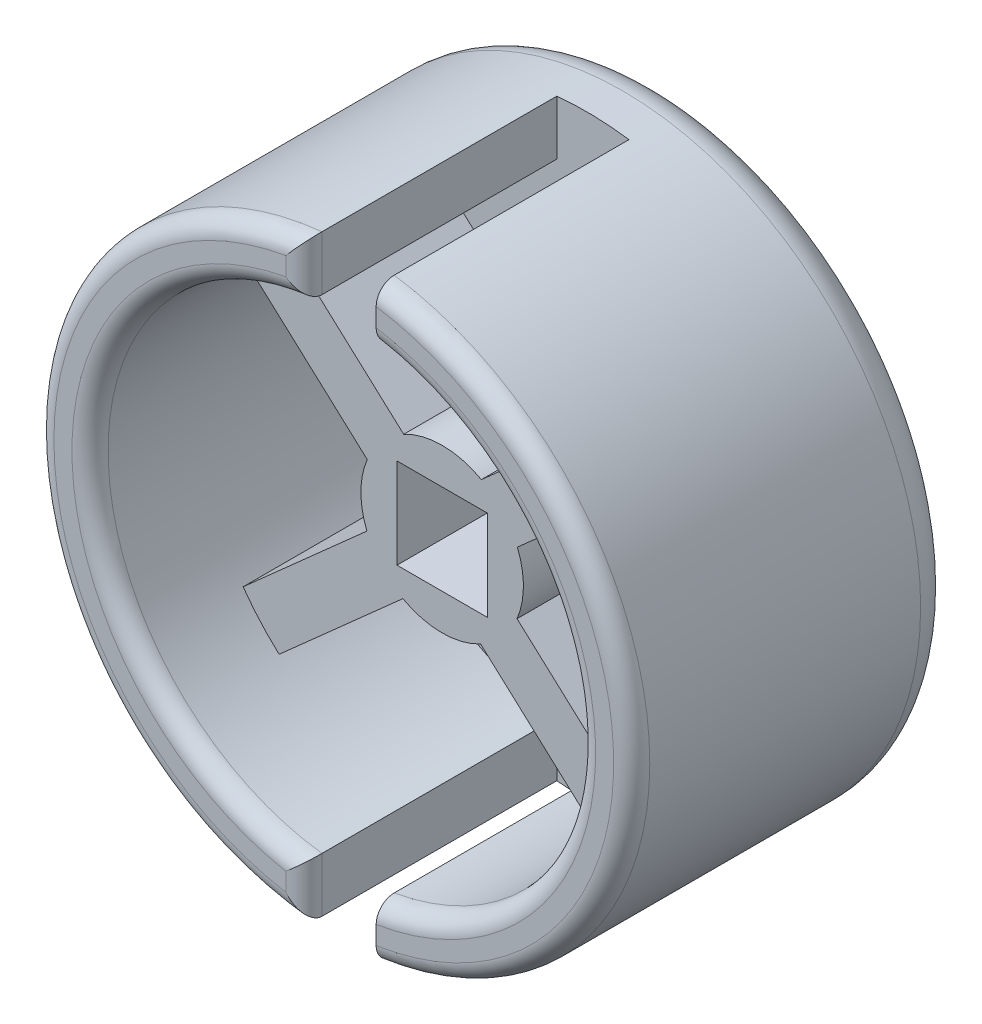
from build123d import *

# Parameters (mm, degrees)
SKETCH_1_R          = 8.25
SKETCH_1_R_2        = 6.75
EXTRUDE_1_DEPTH     = 7
EXTRUDE_START       = 2
SKETCH_2_R          = 8.25
EXTRUDE_1_2_DEPTH   = 2
EXTRUDE_3_DEPTH     = 4
SKETCH_3_W          = 2.5
SKETCH_3_H          = 2.5
CUT_EXTRUDE_1_DEPTH = 15.735162028
SKETCH_6_W          = 2
SKETCH_6_H          = 3.283082556
SKETCH_6_H_2        = 3.547491889
CUT_EXTRUDE_2_DEPTH = 7
FILLET_1_R          = 1
FILLET_2_R          = 0.5


with BuildPart() as part:
    # Эскиз1 → Extrude 1 (new body)
    with BuildSketch(Plane.XY):
        Circle(SKETCH_1_R)
        Circle(SKETCH_1_R_2, mode=Mode.SUBTRACT)
    extrude(amount=EXTRUDE_1_DEPTH)

    # Эскиз2 → Extrude 1 2 (add)
    with BuildSketch(Plane(origin=(0, 0, 0), x_dir=(-1, 0, 0), z_dir=(0, 0, -1)).offset(EXTRUDE_START)):
        Circle(SKETCH_2_R)
    extrude(amount=-EXTRUDE_1_2_DEPTH)

    # Эскиз4 → Бобышка-Вытянуть3 (add)
    with BuildSketch(Plane.XY):
        with BuildLine():
            Line((2.07406055, -0.872222927), (5.968591922, -4.413472559))
            Line((5.968591922, -4.413472559), (4.959463137, -5.523273935))
            Line((4.959463137, -5.523273935), (1.064931765, -1.982024303))
            ThreePointArc((1.064931765, -1.982024303), (-0.012257169, -2.249966613), (-1.08646291, -1.970304125))
            Line((-1.08646291, -1.970304125), (-4.961140395, -5.41713434))
            Line((-4.961140395, -5.41713434), (-5.958117889, -4.296404276))
            Line((-5.958117889, -4.296404276), (-2.083440404, -0.849574061))
            ThreePointArc((-2.083440404, -0.849574061), (-2.249966613, 0.012257169), (-2.07406055, 0.872222927))
            Line((-2.07406055, 0.872222927), (-5.968591922, 4.413472559))
            Line((-5.968591922, 4.413472559), (-4.959463137, 5.523273935))
            Line((-4.959463137, 5.523273935), (-1.064931765, 1.982024303))
            ThreePointArc((-1.064931765, 1.982024303), (0.012257169, 2.249966613), (1.08646291, 1.970304125))
            Line((1.08646291, 1.970304125), (4.961140395, 5.41713434))
            Line((4.961140395, 5.41713434), (5.958117889, 4.296404276))
            Line((5.958117889, 4.296404276), (2.083440404, 0.849574061))
            ThreePointArc((2.083440404, 0.849574061), (2.249966613, -0.012257169), (2.07406055, -0.872222927))
        make_face()
    extrude(amount=EXTRUDE_3_DEPTH)

    # Эскиз3 → Вырез-Вытянуть1 (cut, through all)
    with BuildSketch(Plane(origin=(0, 0, -2), x_dir=(-1, 0, 0), z_dir=(0, 0, -1))):
        Rectangle(SKETCH_3_W, SKETCH_3_H)
    extrude(amount=-CUT_EXTRUDE_1_DEPTH, mode=Mode.SUBTRACT)

    # Эскиз6 → Вырез-Вытянуть2 (cut)
    with BuildSketch(Plane.XY.offset(7)):
        with Locations((0.173720833, 7.205154333)):
            Rectangle(SKETCH_6_W, SKETCH_6_H)
        with Locations((0.173720833, -7.513631889)):
            Rectangle(SKETCH_6_W, SKETCH_6_H_2)
    extrude(amount=-CUT_EXTRUDE_2_DEPTH, mode=Mode.SUBTRACT)

    # Скругление1
    fillet_1_edges = [part.edges().sort_by_distance(p)[0] for p in [
        (8.25, 0, -2),
    ]]
    fillet(fillet_1_edges, radius=FILLET_1_R)

    # Скругление2
    # the kernel refuses this fillet: 0.5 mm, written as the material it takes off along each edge
    with BuildSketch(Plane(origin=(0, 0, 7), x_dir=(1, 0, 0), z_dir=(0, -1, 0))) as fillet_2_piece_1:
        with BuildLine():
            CenterArc((8.25 - FILLET_2_R, -FILLET_2_R), FILLET_2_R, 0, 90)
            Line((8.25, -FILLET_2_R), (8.25, 0))
            Line((8.25, 0), (8.25 - FILLET_2_R, 0))
        make_face()
    revolve(axis=Axis((0, 0, 7), (0, 0, 1)), revolution_arc=90.504884873, mode=Mode.SUBTRACT)
    with BuildSketch(Plane(origin=(0, 0, 7), x_dir=(0.06267760440756695, 0.9980338260328296, 0), z_dir=(0.9980338260328296, -0.06267760440756695, 0))) as fillet_2_piece_2:
        with BuildLine():
            CenterArc((6.75 + FILLET_2_R, -FILLET_2_R), FILLET_2_R, 90, 90)
            Line((6.75 + FILLET_2_R, 0), (6.75, 0))
            Line((6.75, 0), (6.75, -FILLET_2_R))
        make_face()
    revolve(axis=Axis((0, 0, 7), (0, 0, 1)), revolution_arc=187.187035343, mode=Mode.SUBTRACT)
    with BuildSketch(Plane(origin=(0, 0, 7), x_dir=(-0.01064718913448663, 0.9999433170752903, 0), z_dir=(-0.9999433170752903, -0.01064718913448663, 0))) as fillet_2_piece_3:
        with BuildLine():
            CenterArc((6.75 + FILLET_2_R, FILLET_2_R), FILLET_2_R, 180, 90)
            Line((6.75 + FILLET_2_R, 0), (6.75, 0))
            Line((6.75, 0), (6.75, FILLET_2_R))
        make_face()
    revolve(axis=Axis((0, 0, 7), (0, 0, -1)), revolution_arc=181.220101055, mode=Mode.SUBTRACT)
    with BuildSketch(Plane(origin=(-0.826279167, 9.458517694, 7), x_dir=(0, 0, -1), z_dir=(0, -1, 0))) as fillet_2_piece_4:
        with BuildLine():
            CenterArc((FILLET_2_R, -FILLET_2_R), FILLET_2_R, 90, 90)
            Line((0, -FILLET_2_R), (0, 0))
            Line((0, 0), (FILLET_2_R, 0))
        make_face()
    extrude(amount=4.009281713, mode=Mode.SUBTRACT)
    with BuildSketch(Plane(origin=(-0.826279167, -5.449235982, 7), x_dir=(-1, 0, 0), z_dir=(0, -1, 0))) as fillet_2_piece_5:
        with BuildLine():
            CenterArc((FILLET_2_R, FILLET_2_R), FILLET_2_R, 180, 90)
            Line((0, FILLET_2_R), (0, 0))
            Line((0, 0), (FILLET_2_R, 0))
        make_face()
    extrude(amount=4.009281713, mode=Mode.SUBTRACT)
    with BuildSketch(Plane(origin=(0, 0, 7), x_dir=(0.05138276513110792, 0.9986790332471597, 0), z_dir=(0.9986790332471597, -0.05138276513110792, 0))) as fillet_2_piece_6:
        with BuildLine():
            CenterArc((8.25 - FILLET_2_R, -FILLET_2_R), FILLET_2_R, 0, 90)
            Line((8.25 - FILLET_2_R, 0), (8.25, 0))
            Line((8.25, 0), (8.25, -FILLET_2_R))
        make_face()
    revolve(axis=Axis((0, 0, 7), (0, 0, 1)), revolution_arc=185.890625165, mode=Mode.SUBTRACT)
    with BuildSketch(Plane(origin=(0, 0, 7), x_dir=(-0.008811789331912054, -0.9999611754307114, 0), z_dir=(-0.9999611754307114, 0.008811789331912054, 0))) as fillet_2_piece_7:
        with BuildLine():
            CenterArc((8.25 - FILLET_2_R, -FILLET_2_R), FILLET_2_R, 0, 90)
            Line((8.25 - FILLET_2_R, 0), (8.25, 0))
            Line((8.25, 0), (8.25, -FILLET_2_R))
        make_face()
    revolve(axis=Axis((0, 0, 7), (0, 0, 1)), revolution_arc=90.504884873, mode=Mode.SUBTRACT)


solid = part.part
